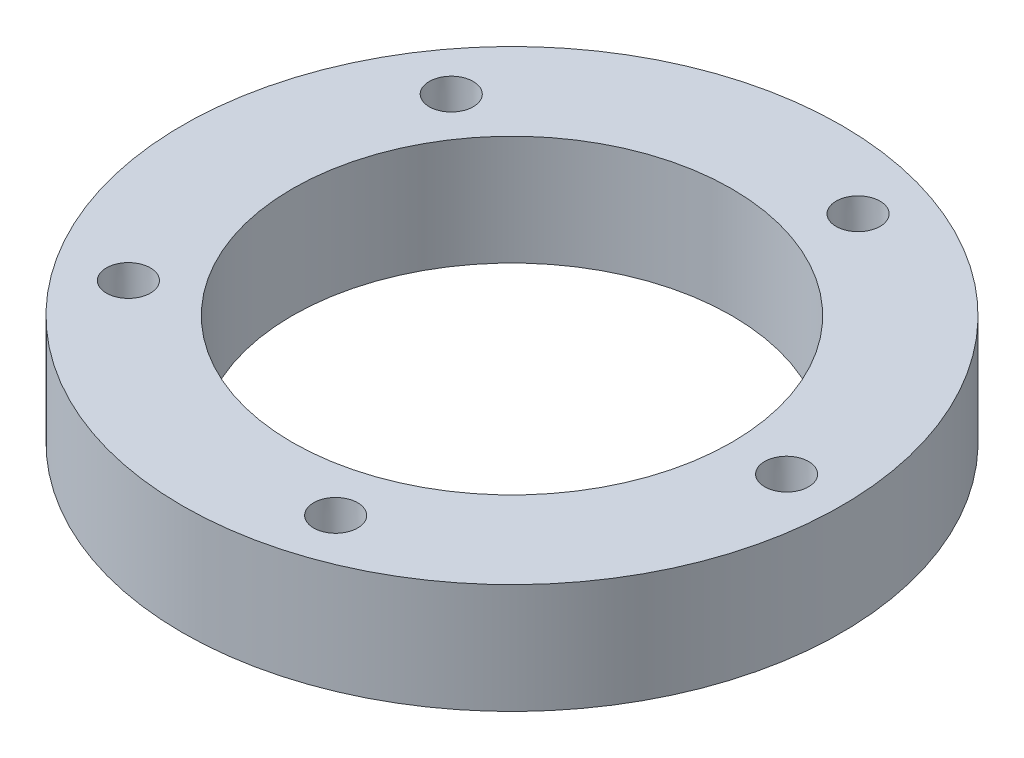
from build123d import *

# Parameters (mm, degrees)
SKETCH1_R                    = 15
SKETCH1_R_2                  = 10
BOSS_EXTRUDE2_DEPTH          = 5
SKETCH2_R                    = 1
CUT_EXTRUDE1_DEPTH           = 5
CUT_EXTRUDE1_DRAFT           = -2
CUT_EXTRUDE1_PROFILE_2_DEPTH = 5
CUT_EXTRUDE1_PROFILE_2_DRAFT = -2
CUT_EXTRUDE1_PROFILE_3_DEPTH = 5
CUT_EXTRUDE1_PROFILE_3_DRAFT = -2
CUT_EXTRUDE1_PROFILE_4_DEPTH = 5
CUT_EXTRUDE1_PROFILE_4_DRAFT = -2
CUT_EXTRUDE1_PROFILE_5_DEPTH = 5
CUT_EXTRUDE1_PROFILE_5_DRAFT = -2


with BuildPart() as part:
    # Sketch1 → Boss-Extrude2 (new body)
    with BuildSketch(Plane(origin=(0, 0, 0), x_dir=(1, 0, 0), z_dir=(0, 1, 0))):
        Circle(SKETCH1_R)
        Circle(SKETCH1_R_2, mode=Mode.SUBTRACT)
    extrude(amount=BOSS_EXTRUDE2_DEPTH)


with BuildPart() as cut_extrude1_tool:
    # Sketch2 → Cut-Extrude1 (with draft: the straight prism first)
    with BuildSketch(Plane(origin=(0, 5, 0), x_dir=(1, 0, 0), z_dir=(0, 1, 0))):
        with Locations((-10.11271243, 7.347315654)):
            Circle(SKETCH2_R)
    extrude(amount=-CUT_EXTRUDE1_DEPTH)
    # Cut-Extrude1: the draft: its side faces are tilted about the plane it starts from
    cut_extrude1_sides = [cut_extrude1_tool.faces().sort_by_distance(p)[0] for p in [
        (-11.11271243, 2.5, -7.347315654),
    ]]
    draft(cut_extrude1_sides, Plane(origin=(0, 5, 0), x_dir=(1, 0, 0), z_dir=(0, 1, 0)), CUT_EXTRUDE1_DRAFT)


with BuildPart() as part_1:
    add(part.part)

    # Cut-Extrude1: cut by cut_extrude1_tool
    add(cut_extrude1_tool.part, mode=Mode.SUBTRACT)


with BuildPart() as cut_extrude1_profile_2_tool:
    # Sketch2 → Cut-Extrude1 profile 2 (with draft: the straight prism first)
    with BuildSketch(Plane(origin=(0, 5, 0), x_dir=(1, 0, 0), z_dir=(0, 1, 0))):
        with Locations((-10.11271243, -7.347315654)):
            Circle(SKETCH2_R)
    extrude(amount=-CUT_EXTRUDE1_PROFILE_2_DEPTH)
    # Cut-Extrude1 profile 2: the draft: its side faces are tilted about the plane it starts from
    cut_extrude1_profile_2_sides = [cut_extrude1_profile_2_tool.faces().sort_by_distance(p)[0] for p in [
        (-11.11271243, 2.5, 7.347315654),
    ]]
    draft(cut_extrude1_profile_2_sides, Plane(origin=(0, 5, 0), x_dir=(1, 0, 0), z_dir=(0, 1, 0)), CUT_EXTRUDE1_PROFILE_2_DRAFT)


with BuildPart() as part_2:
    add(part_1.part)

    # Cut-Extrude1 profile 2: cut by cut_extrude1_profile_2_tool
    add(cut_extrude1_profile_2_tool.part, mode=Mode.SUBTRACT)


with BuildPart() as cut_extrude1_profile_3_tool:
    # Sketch2 → Cut-Extrude1 profile 3 (with draft: the straight prism first)
    with BuildSketch(Plane(origin=(0, 5, 0), x_dir=(1, 0, 0), z_dir=(0, 1, 0))):
        with Locations((3.86271243, 11.888206454)):
            Circle(SKETCH2_R)
    extrude(amount=-CUT_EXTRUDE1_PROFILE_3_DEPTH)
    # Cut-Extrude1 profile 3: the draft: its side faces are tilted about the plane it starts from
    cut_extrude1_profile_3_sides = [cut_extrude1_profile_3_tool.faces().sort_by_distance(p)[0] for p in [
        (2.86271243, 2.5, -11.888206454),
    ]]
    draft(cut_extrude1_profile_3_sides, Plane(origin=(0, 5, 0), x_dir=(1, 0, 0), z_dir=(0, 1, 0)), CUT_EXTRUDE1_PROFILE_3_DRAFT)


with BuildPart() as part_3:
    add(part_2.part)

    # Cut-Extrude1 profile 3: cut by cut_extrude1_profile_3_tool
    add(cut_extrude1_profile_3_tool.part, mode=Mode.SUBTRACT)


with BuildPart() as cut_extrude1_profile_4_tool:
    # Sketch2 → Cut-Extrude1 profile 4 (with draft: the straight prism first)
    with BuildSketch(Plane(origin=(0, 5, 0), x_dir=(1, 0, 0), z_dir=(0, 1, 0))):
        with Locations((3.86271243, -11.888206454)):
            Circle(SKETCH2_R)
    extrude(amount=-CUT_EXTRUDE1_PROFILE_4_DEPTH)
    # Cut-Extrude1 profile 4: the draft: its side faces are tilted about the plane it starts from
    cut_extrude1_profile_4_sides = [cut_extrude1_profile_4_tool.faces().sort_by_distance(p)[0] for p in [
        (2.86271243, 2.5, 11.888206454),
    ]]
    draft(cut_extrude1_profile_4_sides, Plane(origin=(0, 5, 0), x_dir=(1, 0, 0), z_dir=(0, 1, 0)), CUT_EXTRUDE1_PROFILE_4_DRAFT)


with BuildPart() as part_4:
    add(part_3.part)

    # Cut-Extrude1 profile 4: cut by cut_extrude1_profile_4_tool
    add(cut_extrude1_profile_4_tool.part, mode=Mode.SUBTRACT)


with BuildPart() as cut_extrude1_profile_5_tool:
    # Sketch2 → Cut-Extrude1 profile 5 (with draft: the straight prism first)
    with BuildSketch(Plane(origin=(0, 5, 0), x_dir=(1, 0, 0), z_dir=(0, 1, 0))):
        with Locations((12.5, 0)):
            Circle(SKETCH2_R)
    extrude(amount=-CUT_EXTRUDE1_PROFILE_5_DEPTH)
    # Cut-Extrude1 profile 5: the draft: its side faces are tilted about the plane it starts from
    cut_extrude1_profile_5_sides = [cut_extrude1_profile_5_tool.faces().sort_by_distance(p)[0] for p in [
        (11.5, 2.5, 0),
    ]]
    draft(cut_extrude1_profile_5_sides, Plane(origin=(0, 5, 0), x_dir=(1, 0, 0), z_dir=(0, 1, 0)), CUT_EXTRUDE1_PROFILE_5_DRAFT)


with BuildPart() as part_5:
    add(part_4.part)

    # Cut-Extrude1 profile 5: cut by cut_extrude1_profile_5_tool
    add(cut_extrude1_profile_5_tool.part, mode=Mode.SUBTRACT)


solid = part_5.part
